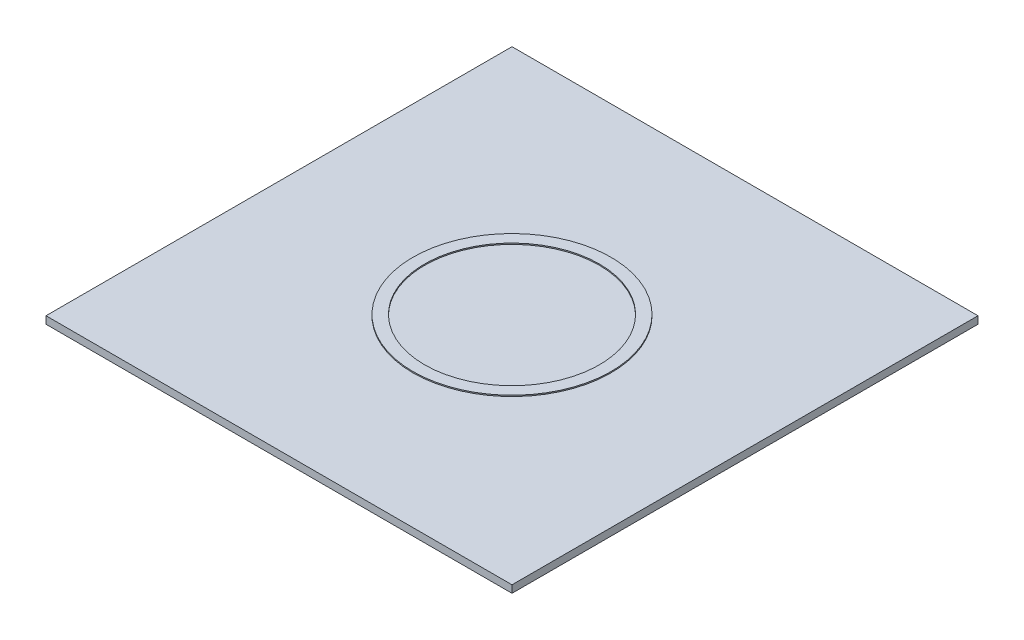
from build123d import *

# Parameters (mm, degrees)
SKETCH1_W           = 400
SKETCH1_H           = 400
BOSS_EXTRUDE1_DEPTH = 6.35
SKETCH2_R           = 85
SKETCH2_R_2         = 75
BOSS_EXTRUDE2_DEPTH = 1


with BuildPart() as part:
    # Sketch1 → Boss-Extrude1 (new body)
    with BuildSketch(Plane(origin=(0, 0, 0), x_dir=(1, 0, 0), z_dir=(0, 1, 0))):
        with Locations((200, -200)):
            Rectangle(SKETCH1_W, SKETCH1_H)
    extrude(amount=BOSS_EXTRUDE1_DEPTH)

    # Sketch2 → Boss-Extrude2 (add)
    with BuildSketch(Plane(origin=(0, 6.35, 0), x_dir=(1, 0, 0), z_dir=(0, 1, 0))):
        with Locations((200, -200)):
            Circle(SKETCH2_R)
        with Locations((200, -200)):
            Circle(SKETCH2_R_2, mode=Mode.SUBTRACT)
    extrude(amount=BOSS_EXTRUDE2_DEPTH)


solid = part.part
